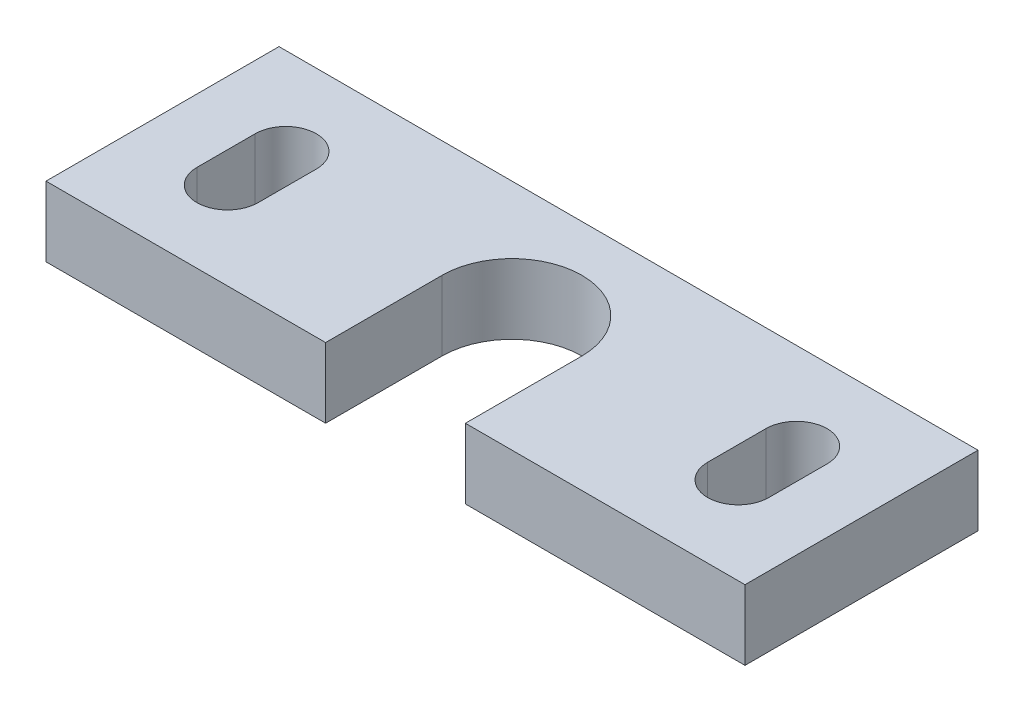
from build123d import *

# Parameters (mm, degrees)
BOSS_EXTRUDE1_DEPTH = 6


with BuildPart() as part:
    # Sketch1 → Boss-Extrude1 (new body)
    with BuildSketch(Plane(origin=(0, 0, 0), x_dir=(1, 0, 0), z_dir=(0, 1, 0))):
        with BuildLine():
            Line((0, 0), (24, 0))
            Line((24, 0), (24, 10))
            ThreePointArc((24, 10), (30, 16), (36, 10))
            Line((36, 10), (36, 0))
            Line((36, 0), (60, 0))
            Line((60, 0), (60, 20))
            Line((60, 20), (0, 20))
            Line((0, 20), (0, 0))
        make_face()
        with BuildLine():
            Line((10.705, 12.5), (10.705, 7.5))
            ThreePointArc((10.705, 7.5), (8.08, 4.875), (5.455, 7.5))
            Line((5.455, 7.5), (5.455, 12.5))
            ThreePointArc((5.455, 12.5), (8.08, 15.125), (10.705, 12.5))
        make_face(mode=Mode.SUBTRACT)
        with BuildLine():
            Line((49.295, 12.5), (49.295, 7.5))
            ThreePointArc((49.295, 7.5), (51.92, 4.875), (54.545, 7.5))
            Line((54.545, 7.5), (54.545, 12.5))
            ThreePointArc((54.545, 12.5), (51.92, 15.125), (49.295, 12.5))
        make_face(mode=Mode.SUBTRACT)
    extrude(amount=BOSS_EXTRUDE1_DEPTH)


solid = part.part
